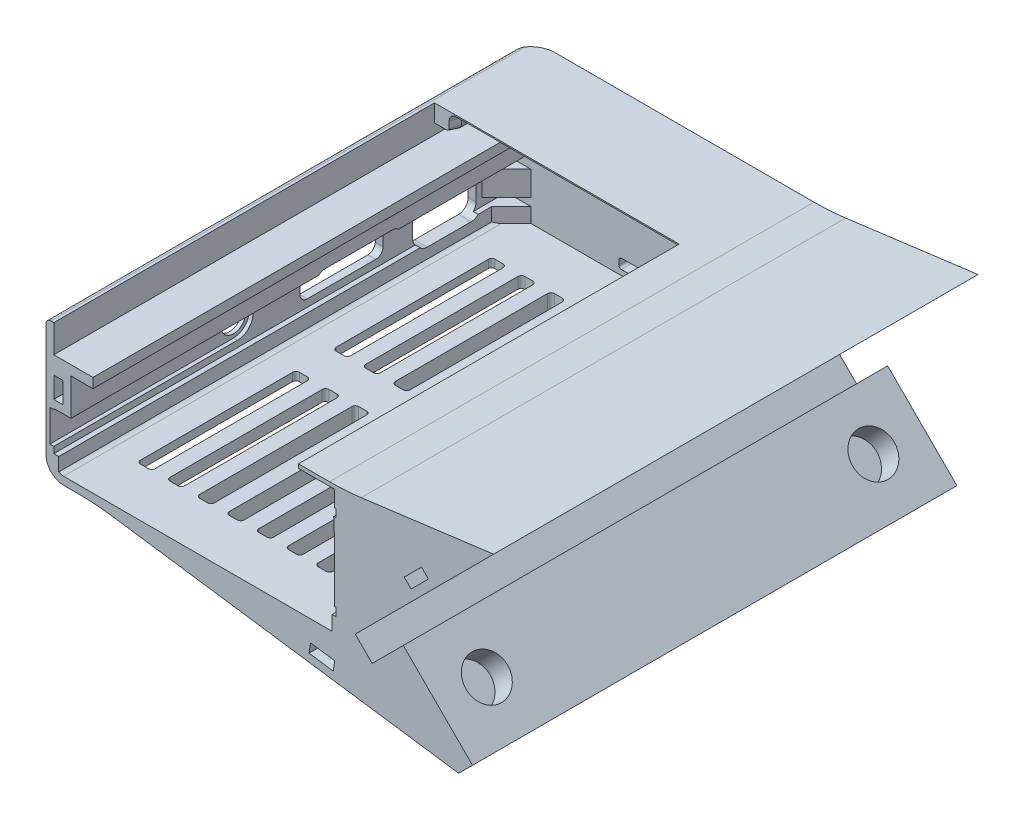
from build123d import *
from OCP.BRepFilletAPI import BRepFilletAPI_MakeChamfer
from build123d.topology import SkipClean

# Parameters (mm, degrees)
BOSS_EXTRUDE1_DEPTH = 94
CUT_EXTRUDE1_DEPTH  = 92.5
CHAMFER1_SIZE       = 5
BOSS_EXTRUDE2_DEPTH = 14.7
BOSS_EXTRUDE3_REACH = 116.541
BOSS_EXTRUDE4_DEPTH = 5
BOSS_EXTRUDE9_REACH = 117.561
SKETCH18_W          = 0.5
SKETCH18_H          = 3
SKETCH18_W_2        = 1
CUT_EXTRUDE2_REACH  = 117.561
SKETCH6_R           = 2.5
CUT_EXTRUDE3_DEPTH  = 0.8
CUT_EXTRUDE4_DEPTH  = 115.343911075
BOSS_EXTRUDE5_REACH = 117.561
CUT_EXTRUDE5_DEPTH  = 120.663194007
BOSS_EXTRUDE6_START = -5
BOSS_EXTRUDE6_DEPTH = 99
FILLET1_R           = 50
FILLET2_R           = 50
SKETCH12_W          = 1.9
SKETCH12_H          = 4.3
CUT_EXTRUDE6_DEPTH  = 10
SKETCH13_R          = 4.25
CUT_EXTRUDE7_DEPTH  = 5
CUT_EXTRUDE8_REACH  = 133.781
SKETCH14_W          = 25
SKETCH14_H          = 2
CUT_EXTRUDE9_DEPTH  = 135.589523374
CHAMFER2_SIZE       = 2
CHAMFER2_SIZE2      = 0.535898385


with BuildPart() as part:
    # Sketch1 → Boss-Extrude1 (new body)
    with BuildSketch(Plane.XY):
        with BuildLine():
            Line((3.6, 0), (61.2, 0))
            Line((61.2, 0), (61.2, 27.8))
            Line((61.2, 27.8), (49.6, 27.8))
            Line((49.6, 27.8), (1.6, 27.8))
            Line((1.6, 27.8), (1, 27.8))
            ThreePointArc((1, 27.8), (0.292893219, 27.507106781), (0, 26.8))
            Line((0, 26.8), (0, 3.6))
            ThreePointArc((0, 3.6), (1.054415588, 1.054415588), (3.6, 0))
        make_face()
    extrude(amount=BOSS_EXTRUDE1_DEPTH)

    # Sketch2 → Cut-Extrude1 (cut)
    with BuildSketch(Plane.XY.offset(94)):
        with BuildLine():
            Line((51.6, 27), (51.6, 27.8))
            Line((51.6, 27.8), (1.6, 27.8))
            Line((1.6, 27.8), (1.6, 22.1))
            Line((1.6, 22.1), (9.6, 22.1))
            Line((9.6, 22.1), (9.6, 20.1))
            Line((9.6, 20.1), (5.1, 20.1))
            Line((5.1, 20.1), (5.1, 12.6))
            Line((5.1, 12.6), (1.6, 12.6))
            Line((1.6, 12.6), (1.6, 3.6))
            ThreePointArc((1.6, 3.6), (2.185786438, 2.185786438), (3.6, 1.6))
            Line((3.6, 1.6), (59, 1.6))
            Line((59, 1.6), (59, 4.6))
            Line((59, 4.6), (59.3, 4.6))
            Line((59.3, 4.6), (59.3, 6.2))
            Line((59.3, 6.2), (59, 6.2))
            Line((59, 6.2), (59, 22.1))
            Line((59, 22.1), (59.3, 22.1))
            Line((59.3, 22.1), (59.3, 23.7))
            Line((59.3, 23.7), (59, 23.7))
            Line((59, 23.7), (59, 27))
            Line((59, 27), (51.6, 27))
        make_face()
    extrude(amount=-CUT_EXTRUDE1_DEPTH, mode=Mode.SUBTRACT)

    # Chamfer1
    chamfer1_edges = [part.edges().sort_by_distance(p)[0] for p in [
        (59, 3.1, 1.5),
    ]]
    chamfer(chamfer1_edges, length=CHAMFER1_SIZE)

    # Sketch3 → Boss-Extrude2 (add)
    with BuildSketch(Plane.XY.offset(1.5)):
        with BuildLine():
            Line((51.6, 27.8), (1.6, 27.8))
            Line((1.6, 27.8), (1.6, 23.7))
            Line((1.6, 23.7), (4.1, 23.7))
            ThreePointArc((4.1, 23.7), (4.807106781, 23.992893219), (5.1, 24.7))
            Line((5.1, 24.7), (5.1, 26))
            ThreePointArc((5.1, 26), (5.392893219, 26.707106781), (6.1, 27))
            Line((6.1, 27), (51.6, 27))
            Line((51.6, 27), (51.6, 27.8))
        make_face()
    extrude(amount=BOSS_EXTRUDE2_DEPTH)

    # Sketch4 → Boss-Extrude3 (add, up to next)
    with BuildSketch(Plane(origin=(0, 4.6, 0), x_dir=(1, 0, 0), z_dir=(0, 1, 0)), mode=Mode.PRIVATE) as boss_extrude3_sk1:
        Polygon((1.6, -1.5), (6.6, -1.5), (1.6, -6.5), align=None)
    boss_extrude3_tool1 = extrude(boss_extrude3_sk1.sketch, amount=-BOSS_EXTRUDE3_REACH, mode=Mode.PRIVATE) - part.part
    add(boss_extrude3_tool1.solids().sort_by_distance((3.266667, 4.6, 3.166667))[0])

    # Sketch5 → Boss-Extrude4 (add)
    with BuildSketch(Plane.XZ.offset(-6.2)):
        Polygon((54, 1.5), (59, 6.5), (59, 1.5), align=None)
        Polygon((1.6, 1.5), (6.6, 1.5), (1.6, 6.5), align=None)
    extrude(amount=-BOSS_EXTRUDE4_DEPTH)

    # Sketch18 → Boss-Extrude9 (add, up to next)
    with BuildSketch(Plane.XY.offset(94), mode=Mode.PRIVATE) as boss_extrude9_sk1:
        with Locations((58.75, 3.1)):
            Rectangle(SKETCH18_W, SKETCH18_H)
    boss_extrude9_tool1 = extrude(boss_extrude9_sk1.sketch, amount=-BOSS_EXTRUDE9_REACH, mode=Mode.PRIVATE) - part.part
    # Sketch18 → Boss-Extrude9 (add, up to next)
    with BuildSketch(Plane.XY.offset(94), mode=Mode.PRIVATE) as boss_extrude9_sk2:
        with Locations((2.1, 3.1)):
            Rectangle(SKETCH18_W_2, SKETCH18_H)
    boss_extrude9_tool2 = extrude(boss_extrude9_sk2.sketch, amount=-BOSS_EXTRUDE9_REACH, mode=Mode.PRIVATE) - part.part
    # Sketch18 → Boss-Extrude9 (add, up to next)
    with BuildSketch(Plane.XY.offset(94), mode=Mode.PRIVATE) as boss_extrude9_sk3:
        Polygon((59, 22.1), (58.8, 22.1), (59, 17.1), align=None)
    boss_extrude9_tool3 = extrude(boss_extrude9_sk3.sketch, amount=-BOSS_EXTRUDE9_REACH, mode=Mode.PRIVATE) - part.part
    add(boss_extrude9_tool1.solids().sort_by_distance((58.75, 3.1, 94))[0])
    add(boss_extrude9_tool2.solids().sort_by_distance((2.1, 3.1, 94))[0])
    add(boss_extrude9_tool3.solids().sort_by_distance((58.933333, 20.433333, 94))[0])

    # Sketch6 → Cut-Extrude2 (cut, up to next)
    with BuildSketch(Plane.ZY, mode=Mode.PRIVATE) as cut_extrude2_sk1:
        with Locations((56.5, 9.15)):
            Circle(SKETCH6_R)
    cut_extrude2_tool1 = extrude(cut_extrude2_sk1.sketch, amount=-CUT_EXTRUDE2_REACH, mode=Mode.PRIVATE) & part.part
    # Sketch6 → Cut-Extrude2 (cut, up to next)
    with BuildSketch(Plane.ZY, mode=Mode.PRIVATE) as cut_extrude2_sk2:
        with BuildLine():
            Line((9.7, 12), (18.7, 12))
            ThreePointArc((18.7, 12), (20.114213562, 11.414213562), (20.7, 10))
            Line((20.7, 10), (20.7, 6))
            ThreePointArc((20.7, 6), (20.114213562, 4.585786438), (18.7, 4))
            Line((18.7, 4), (9.7, 4))
            ThreePointArc((9.7, 4), (8.285786438, 4.585786438), (7.7, 6))
            Line((7.7, 6), (7.7, 10))
            ThreePointArc((7.7, 10), (8.285786438, 11.414213562), (9.7, 12))
        make_face()
    cut_extrude2_tool2 = extrude(cut_extrude2_sk2.sketch, amount=-CUT_EXTRUDE2_REACH, mode=Mode.PRIVATE) & part.part
    # Sketch6 → Cut-Extrude2 (cut, up to next)
    with BuildSketch(Plane.ZY, mode=Mode.PRIVATE) as cut_extrude2_sk3:
        with BuildLine():
            Line((28.2, 13.1), (42.2, 13.1))
            ThreePointArc((42.2, 13.1), (43.260660172, 12.660660172), (43.7, 11.6))
            Line((43.7, 11.6), (43.7, 7.6))
            ThreePointArc((43.7, 7.6), (43.260660172, 6.539339828), (42.2, 6.1))
            Line((42.2, 6.1), (28.2, 6.1))
            ThreePointArc((28.2, 6.1), (27.139339828, 6.539339828), (26.7, 7.6))
            Line((26.7, 7.6), (26.7, 11.6))
            ThreePointArc((26.7, 11.6), (27.139339828, 12.660660172), (28.2, 13.1))
        make_face()
    cut_extrude2_tool3 = extrude(cut_extrude2_sk3.sketch, amount=-CUT_EXTRUDE2_REACH, mode=Mode.PRIVATE) & part.part
    add(cut_extrude2_tool1.solids().sort_by_distance((0, 9.15, 56.5))[0], mode=Mode.SUBTRACT)
    add(cut_extrude2_tool2.solids().sort_by_distance((0, 8, 14.2))[0], mode=Mode.SUBTRACT)
    add(cut_extrude2_tool3.solids().sort_by_distance((0, 9.6, 35.2))[0], mode=Mode.SUBTRACT)

    # Sketch7 → Cut-Extrude3 (cut)
    with BuildSketch(Plane(origin=(1.6, 0, 0), x_dir=(0, 0, -1), z_dir=(1, 0, 0))):
        with BuildLine():
            Line((-56.5, 5.9), (-94, 5.9))
            Line((-94, 5.9), (-94, 12.4))
            Line((-94, 12.4), (-56.5, 12.4))
            ThreePointArc((-56.5, 12.4), (-53.25, 9.15), (-56.5, 5.9))
        make_face()
    extrude(amount=-CUT_EXTRUDE3_DEPTH, mode=Mode.SUBTRACT)

    # Sketch8 → Cut-Extrude4 (cut, through all)
    with BuildSketch(Plane.XY.offset(1.5)):
        with BuildLine():
            Line((25.1, 4.7), (37.9, 4.7))
            ThreePointArc((37.9, 4.7), (38.253553391, 4.553553391), (38.4, 4.2))
            Line((38.4, 4.2), (38.4, 3.2))
            ThreePointArc((38.4, 3.2), (38.253553391, 2.846446609), (37.9, 2.7))
            Line((37.9, 2.7), (25.1, 2.7))
            ThreePointArc((25.1, 2.7), (24.746446609, 2.846446609), (24.6, 3.2))
            Line((24.6, 3.2), (24.6, 4.2))
            ThreePointArc((24.6, 4.2), (24.746446609, 4.553553391), (25.1, 4.7))
        make_face()
    extrude(amount=-CUT_EXTRUDE4_DEPTH, mode=Mode.SUBTRACT)

    # Boss-Extrude5: up to this face of the body (flat: up to its plane)
    boss_extrude5_end = Plane(part.part.faces().sort_by_distance((32.4, 0, 47))[0])
    # Sketch9 → Boss-Extrude5 (add, up to the picked face)
    with BuildSketch(Plane(origin=(0, 27.8, 0), x_dir=(1, 0, 0), z_dir=(0, 1, 0)), mode=Mode.PRIVATE) as boss_extrude5_sk1:
        with BuildLine():
            Line((0, 0), (61.2, 0))
            Line((61.2, 0), (61.2, 5))
            Line((61.2, 5), (5, 5))
            ThreePointArc((5, 5), (1.464466094, 3.535533906), (0, 0))
        make_face()
    boss_extrude5_tool1 = split(extrude(boss_extrude5_sk1.sketch, amount=-BOSS_EXTRUDE5_REACH, mode=Mode.PRIVATE), bisect_by=boss_extrude5_end, keep=Keep.BOTH, mode=Mode.PRIVATE)
    add(boss_extrude5_tool1.solids().sort_by(Axis((31.126148, 27.8, -2.475317), (0, -1, 0)))[0])

    # Sketch10 → Cut-Extrude5 (cut, through all)
    with SkipClean():  # the faces are left unmerged after this step: merging them gives an invalid solid
        with BuildSketch(Plane.XY.offset(94)):
            with BuildLine():
                Line((1, 27.8), (0, 27.8))
                Line((0, 27.8), (0, 26.8))
                ThreePointArc((0, 26.8), (0.292893219, 27.507106781), (1, 27.8))
            make_face()
            with BuildLine():
                Line((0, 3.6), (0, 0))
                Line((0, 0), (3.6, 0))
                ThreePointArc((3.6, 0), (1.054415588, 1.054415588), (0, 3.6))
            make_face()
            with BuildLine():
                Line((38.4, 3.2), (38.4, 4.2))
                ThreePointArc((38.4, 4.2), (38.253553391, 4.553553391), (37.9, 4.7))
                Line((37.9, 4.7), (25.1, 4.7))
                ThreePointArc((25.1, 4.7), (24.746446609, 4.553553391), (24.6, 4.2))
                Line((24.6, 4.2), (24.6, 3.2))
                ThreePointArc((24.6, 3.2), (24.746446609, 2.846446609), (25.1, 2.7))
                Line((25.1, 2.7), (37.9, 2.7))
                ThreePointArc((37.9, 2.7), (38.253553391, 2.846446609), (38.4, 3.2))
            make_face()
        extrude(amount=-CUT_EXTRUDE5_DEPTH, mode=Mode.SUBTRACT)
    add(part.part.scale(1), mode=Mode.REPLACE)  # the faces are merged on a copy

    # Sketch11 → Boss-Extrude6 (add)
    with BuildSketch(Plane.XY.offset(BOSS_EXTRUDE6_START)):
        Polygon((61.2, 27.8), (91.484271247, 31.749094475), (63.2, 3.464823228), (66.664823228, 0), (73.028784258, 6.363961031), (87.170919882, -7.778174593), (84.342492757, -10.606601718), (10, 0), (61.2, 0), align=None)
    extrude(amount=BOSS_EXTRUDE6_DEPTH)

    # Fillet1
    fillet1_edges = [part.edges().sort_by_distance(p)[0] for p in [
        (10, 0, 44.5),
    ]]
    fillet(fillet1_edges, radius=FILLET1_R)

    # Fillet2
    fillet2_edges = [part.edges().sort_by_distance(p)[0] for p in [
        (61.2, 27.8, 44.5),
    ]]
    fillet(fillet2_edges, radius=FILLET2_R)

    # Sketch12 → Cut-Extrude6 (cut)
    with BuildSketch(Plane.XY.offset(94)):
        with Locations((2.55, 16.35)):
            Rectangle(SKETCH12_W, SKETCH12_H)
        Polygon((54.050124402, -2.648270005), (53.767640686, -4.628220244), (58.717516284, -5.334429534), (59, -3.354479295), align=None)
        Polygon((73.208474042, 18.564466094), (74.622687604, 17.150252532), (78.15822151, 20.685786438), (76.744007948, 22.1), align=None)
    extrude(amount=-CUT_EXTRUDE6_DEPTH, mode=Mode.SUBTRACT)

    # Sketch13 → Cut-Extrude7 (cut)
    with BuildSketch(Plane(origin=(39.696372645, 39.696372645, 0), x_dir=(0, 0, -1), z_dir=(0.7071067811865464, 0.7071067811865488, 0))):
        with Locations(Location((-84, -57.139148571, 0), (0, 0, 90))):
            Circle(SKETCH13_R)
        with Locations(Location((-5, -57.139148571, 0), (0, 0, 90))):
            Circle(SKETCH13_R)
    extrude(amount=-CUT_EXTRUDE7_DEPTH, mode=Mode.SUBTRACT)

    # Cut-Extrude8: up to this plane
    cut_extrude8_end = Plane(origin=(59, 0, -63.369787754), z_dir=(-1, 0, 0))
    # Sketch14 → Cut-Extrude8 (cut, up to the surface)
    with BuildSketch(Plane(origin=(47.474547238, -47.474547238, 0), x_dir=(0, 0, -1), z_dir=(0.7071067811865513, -0.7071067811865438, 0)), mode=Mode.PRIVATE) as cut_extrude8_sk1:
        with Locations((-61.5, 53.139148571)):
            Rectangle(SKETCH14_W, SKETCH14_H)
    cut_extrude8_tool1 = split(extrude(cut_extrude8_sk1.sketch, amount=-CUT_EXTRUDE8_REACH, mode=Mode.PRIVATE), bisect_by=cut_extrude8_end, keep=Keep.BOTH, mode=Mode.PRIVATE)
    add(cut_extrude8_tool1.solids().sort_by_distance((85.0496, -9.899495, 61.5))[0], mode=Mode.SUBTRACT)

    # Sketch16 → Cut-Extrude9 (cut, through all)
    with BuildSketch(Plane(origin=(0, 1.6, 0), x_dir=(1, 0, 0), z_dir=(0, 1, 0))):
        with BuildLine():
            Line((9.3, -11.5), (10.9, -11.5))
            ThreePointArc((10.9, -11.5), (11.394974747, -11.705025253), (11.6, -12.2))
            Line((11.6, -12.2), (11.6, -43.3))
            ThreePointArc((11.6, -43.3), (11.394974747, -43.794974747), (10.9, -44))
            Line((10.9, -44), (9.3, -44))
            ThreePointArc((9.3, -44), (8.805025253, -43.794974747), (8.6, -43.3))
            Line((8.6, -43.3), (8.6, -12.2))
            ThreePointArc((8.6, -12.2), (8.805025253, -11.705025253), (9.3, -11.5))
        make_face()
        with BuildLine():
            Line((15.357142857, -11.5), (16.957142857, -11.5))
            ThreePointArc((16.957142857, -11.5), (17.452117604, -11.705025253), (17.657142857, -12.2))
            Line((17.657142857, -12.2), (17.657142857, -43.3))
            ThreePointArc((17.657142857, -43.3), (17.452117604, -43.794974747), (16.957142857, -44))
            Line((16.957142857, -44), (15.357142857, -44))
            ThreePointArc((15.357142857, -44), (14.86216811, -43.794974747), (14.657142857, -43.3))
            Line((14.657142857, -43.3), (14.657142857, -12.2))
            ThreePointArc((14.657142857, -12.2), (14.86216811, -11.705025253), (15.357142857, -11.5))
        make_face()
        with BuildLine():
            Line((21.414285714, -11.5), (23.014285714, -11.5))
            ThreePointArc((23.014285714, -11.5), (23.509260461, -11.705025253), (23.714285714, -12.2))
            Line((23.714285714, -12.2), (23.714285714, -43.3))
            ThreePointArc((23.714285714, -43.3), (23.509260461, -43.794974747), (23.014285714, -44))
            Line((23.014285714, -44), (21.414285714, -44))
            ThreePointArc((21.414285714, -44), (20.919310967, -43.794974747), (20.714285714, -43.3))
            Line((20.714285714, -43.3), (20.714285714, -12.2))
            ThreePointArc((20.714285714, -12.2), (20.919310967, -11.705025253), (21.414285714, -11.5))
        make_face()
        with BuildLine():
            Line((27.471428571, -11.5), (29.071428571, -11.5))
            ThreePointArc((29.071428571, -11.5), (29.566403318, -11.705025253), (29.771428571, -12.2))
            Line((29.771428571, -12.2), (29.771428571, -43.3))
            ThreePointArc((29.771428571, -43.3), (29.566403318, -43.794974747), (29.071428571, -44))
            Line((29.071428571, -44), (27.471428571, -44))
            ThreePointArc((27.471428571, -44), (26.976453825, -43.794974747), (26.771428571, -43.3))
            Line((26.771428571, -43.3), (26.771428571, -12.2))
            ThreePointArc((26.771428571, -12.2), (26.976453825, -11.705025253), (27.471428571, -11.5))
        make_face()
        with BuildLine():
            Line((33.528571429, -11.5), (35.128571429, -11.5))
            ThreePointArc((35.128571429, -11.5), (35.623546175, -11.705025253), (35.828571429, -12.2))
            Line((35.828571429, -12.2), (35.828571429, -43.3))
            ThreePointArc((35.828571429, -43.3), (35.623546175, -43.794974747), (35.128571429, -44))
            Line((35.128571429, -44), (33.528571429, -44))
            ThreePointArc((33.528571429, -44), (33.033596682, -43.794974747), (32.828571429, -43.3))
            Line((32.828571429, -43.3), (32.828571429, -12.2))
            ThreePointArc((32.828571429, -12.2), (33.033596682, -11.705025253), (33.528571429, -11.5))
        make_face()
        with BuildLine():
            Line((39.585714286, -11.5), (41.185714286, -11.5))
            ThreePointArc((41.185714286, -11.5), (41.680689033, -11.705025253), (41.885714286, -12.2))
            Line((41.885714286, -12.2), (41.885714286, -43.3))
            ThreePointArc((41.885714286, -43.3), (41.680689033, -43.794974747), (41.185714286, -44))
            Line((41.185714286, -44), (39.585714286, -44))
            ThreePointArc((39.585714286, -44), (39.090739539, -43.794974747), (38.885714286, -43.3))
            Line((38.885714286, -43.3), (38.885714286, -12.2))
            ThreePointArc((38.885714286, -12.2), (39.090739539, -11.705025253), (39.585714286, -11.5))
        make_face()
        with BuildLine():
            Line((45.642857143, -11.5), (47.242857143, -11.5))
            ThreePointArc((47.242857143, -11.5), (47.73783189, -11.705025253), (47.942857143, -12.2))
            Line((47.942857143, -12.2), (47.942857143, -43.3))
            ThreePointArc((47.942857143, -43.3), (47.73783189, -43.794974747), (47.242857143, -44))
            Line((47.242857143, -44), (45.642857143, -44))
            ThreePointArc((45.642857143, -44), (45.147882396, -43.794974747), (44.942857143, -43.3))
            Line((44.942857143, -43.3), (44.942857143, -12.2))
            ThreePointArc((44.942857143, -12.2), (45.147882396, -11.705025253), (45.642857143, -11.5))
        make_face()
        with BuildLine():
            Line((51.7, -11.5), (53.3, -11.5))
            ThreePointArc((53.3, -11.5), (53.794974747, -11.705025253), (54, -12.2))
            Line((54, -12.2), (54, -43.3))
            ThreePointArc((54, -43.3), (53.794974747, -43.794974747), (53.3, -44))
            Line((53.3, -44), (51.7, -44))
            ThreePointArc((51.7, -44), (51.205025253, -43.794974747), (51, -43.3))
            Line((51, -43.3), (51, -12.2))
            ThreePointArc((51, -12.2), (51.205025253, -11.705025253), (51.7, -11.5))
        make_face()
        with BuildLine():
            Line((15.357142857, -51.5), (16.957142857, -51.5))
            ThreePointArc((16.957142857, -51.5), (17.452117604, -51.705025253), (17.657142857, -52.2))
            Line((17.657142857, -52.2), (17.657142857, -83.3))
            ThreePointArc((17.657142857, -83.3), (17.452117604, -83.794974747), (16.957142857, -84))
            Line((16.957142857, -84), (15.357142857, -84))
            ThreePointArc((15.357142857, -84), (14.86216811, -83.794974747), (14.657142857, -83.3))
            Line((14.657142857, -83.3), (14.657142857, -52.2))
            ThreePointArc((14.657142857, -52.2), (14.86216811, -51.705025253), (15.357142857, -51.5))
        make_face()
        with BuildLine():
            Line((21.414285714, -51.5), (23.014285714, -51.5))
            ThreePointArc((23.014285714, -51.5), (23.509260461, -51.705025253), (23.714285714, -52.2))
            Line((23.714285714, -52.2), (23.714285714, -83.3))
            ThreePointArc((23.714285714, -83.3), (23.509260461, -83.794974747), (23.014285714, -84))
            Line((23.014285714, -84), (21.414285714, -84))
            ThreePointArc((21.414285714, -84), (20.919310967, -83.794974747), (20.714285714, -83.3))
            Line((20.714285714, -83.3), (20.714285714, -52.2))
            ThreePointArc((20.714285714, -52.2), (20.919310967, -51.705025253), (21.414285714, -51.5))
        make_face()
        with BuildLine():
            Line((27.471428571, -51.5), (29.071428571, -51.5))
            ThreePointArc((29.071428571, -51.5), (29.566403318, -51.705025253), (29.771428571, -52.2))
            Line((29.771428571, -52.2), (29.771428571, -83.3))
            ThreePointArc((29.771428571, -83.3), (29.566403318, -83.794974747), (29.071428571, -84))
            Line((29.071428571, -84), (27.471428571, -84))
            ThreePointArc((27.471428571, -84), (26.976453825, -83.794974747), (26.771428571, -83.3))
            Line((26.771428571, -83.3), (26.771428571, -52.2))
            ThreePointArc((26.771428571, -52.2), (26.976453825, -51.705025253), (27.471428571, -51.5))
        make_face()
        with BuildLine():
            Line((33.528571429, -51.5), (35.128571429, -51.5))
            ThreePointArc((35.128571429, -51.5), (35.623546175, -51.705025253), (35.828571429, -52.2))
            Line((35.828571429, -52.2), (35.828571429, -83.3))
            ThreePointArc((35.828571429, -83.3), (35.623546175, -83.794974747), (35.128571429, -84))
            Line((35.128571429, -84), (33.528571429, -84))
            ThreePointArc((33.528571429, -84), (33.033596682, -83.794974747), (32.828571429, -83.3))
            Line((32.828571429, -83.3), (32.828571429, -52.2))
            ThreePointArc((32.828571429, -52.2), (33.033596682, -51.705025253), (33.528571429, -51.5))
        make_face()
        with BuildLine():
            Line((39.585714286, -51.5), (41.185714286, -51.5))
            ThreePointArc((41.185714286, -51.5), (41.680689033, -51.705025253), (41.885714286, -52.2))
            Line((41.885714286, -52.2), (41.885714286, -83.3))
            ThreePointArc((41.885714286, -83.3), (41.680689033, -83.794974747), (41.185714286, -84))
            Line((41.185714286, -84), (39.585714286, -84))
            ThreePointArc((39.585714286, -84), (39.090739539, -83.794974747), (38.885714286, -83.3))
            Line((38.885714286, -83.3), (38.885714286, -52.2))
            ThreePointArc((38.885714286, -52.2), (39.090739539, -51.705025253), (39.585714286, -51.5))
        make_face()
        with BuildLine():
            Line((45.642857143, -51.5), (47.242857143, -51.5))
            ThreePointArc((47.242857143, -51.5), (47.73783189, -51.705025253), (47.942857143, -52.2))
            Line((47.942857143, -52.2), (47.942857143, -83.3))
            ThreePointArc((47.942857143, -83.3), (47.73783189, -83.794974747), (47.242857143, -84))
            Line((47.242857143, -84), (45.642857143, -84))
            ThreePointArc((45.642857143, -84), (45.147882396, -83.794974747), (44.942857143, -83.3))
            Line((44.942857143, -83.3), (44.942857143, -52.2))
            ThreePointArc((44.942857143, -52.2), (45.147882396, -51.705025253), (45.642857143, -51.5))
        make_face()
        with BuildLine():
            Line((51.7, -51.5), (53.3, -51.5))
            ThreePointArc((53.3, -51.5), (53.794974747, -51.705025253), (54, -52.2))
            Line((54, -52.2), (54, -83.3))
            ThreePointArc((54, -83.3), (53.794974747, -83.794974747), (53.3, -84))
            Line((53.3, -84), (51.7, -84))
            ThreePointArc((51.7, -84), (51.205025253, -83.794974747), (51, -83.3))
            Line((51, -83.3), (51, -52.2))
            ThreePointArc((51, -52.2), (51.205025253, -51.705025253), (51.7, -51.5))
        make_face()
        with BuildLine():
            Line((9.3, -51.5), (10.9, -51.5))
            ThreePointArc((10.9, -51.5), (11.394974747, -51.705025253), (11.6, -52.2))
            Line((11.6, -52.2), (11.6, -83.3))
            ThreePointArc((11.6, -83.3), (11.394974747, -83.794974747), (10.9, -84))
            Line((10.9, -84), (9.3, -84))
            ThreePointArc((9.3, -84), (8.805025253, -83.794974747), (8.6, -83.3))
            Line((8.6, -83.3), (8.6, -52.2))
            ThreePointArc((8.6, -52.2), (8.805025253, -51.705025253), (9.3, -51.5))
        make_face()
    extrude(amount=-CUT_EXTRUDE9_DEPTH, mode=Mode.SUBTRACT)

    # Chamfer2: one chamfer whose edges measure the first distance from different faces: ONE call of the kernel's chamfer builder (chamfer() names one face for all edges)
    chamfer2_edges_1 = [part.edges().sort_by_distance(p)[0] for p in [
        (2.85, 23.7, 16.2),
    ]]
    chamfer2_side_1 = [part.faces().sort_by_distance(p)[0] for p in [
        (2.85, 23.7, 8.85),
    ]]
    chamfer2_edges_2 = [part.edges().sort_by_distance(p)[0] for p in [
        (4.807106781, 23.992893219, 16.2),
    ]]
    chamfer2_side_2 = [part.faces().sort_by_distance(p)[0] for p in [
        (4.807106781, 23.992893219, 8.85),
    ]]
    chamfer2_edges_3 = [part.edges().sort_by_distance(p)[0] for p in [
        (5.1, 25.35, 16.2),
    ]]
    chamfer2_side_3 = [part.faces().sort_by_distance(p)[0] for p in [
        (5.1, 25.35, 8.85),
    ]]
    chamfer2_edges_4 = [part.edges().sort_by_distance(p)[0] for p in [
        (5.392893219, 26.707106781, 16.2),
    ]]
    chamfer2_side_4 = [part.faces().sort_by_distance(p)[0] for p in [
        (5.392893219, 26.707106781, 8.85),
    ]]
    chamfer2_edges_5 = [part.edges().sort_by_distance(p)[0] for p in [
        (28.85, 27, 16.2),
    ]]
    chamfer2_side_5 = [part.faces().sort_by_distance(p)[0] for p in [
        (57.93441753, 27, 47.75),
    ]]
    chamfer2 = BRepFilletAPI_MakeChamfer(part.part.solid().wrapped)
    for e in chamfer2_edges_1:
        chamfer2.Add(CHAMFER2_SIZE, CHAMFER2_SIZE2, e.wrapped, chamfer2_side_1[0].wrapped)  # the first distance lies on this face
    for e in chamfer2_edges_2:
        chamfer2.Add(CHAMFER2_SIZE, CHAMFER2_SIZE2, e.wrapped, chamfer2_side_2[0].wrapped)  # the first distance lies on this face
    for e in chamfer2_edges_3:
        chamfer2.Add(CHAMFER2_SIZE, CHAMFER2_SIZE2, e.wrapped, chamfer2_side_3[0].wrapped)  # the first distance lies on this face
    for e in chamfer2_edges_4:
        chamfer2.Add(CHAMFER2_SIZE, CHAMFER2_SIZE2, e.wrapped, chamfer2_side_4[0].wrapped)  # the first distance lies on this face
    for e in chamfer2_edges_5:
        chamfer2.Add(CHAMFER2_SIZE, CHAMFER2_SIZE2, e.wrapped, chamfer2_side_5[0].wrapped)  # the first distance lies on this face
    add(Compound.cast(chamfer2.Shape()), mode=Mode.REPLACE)


solid = part.part
